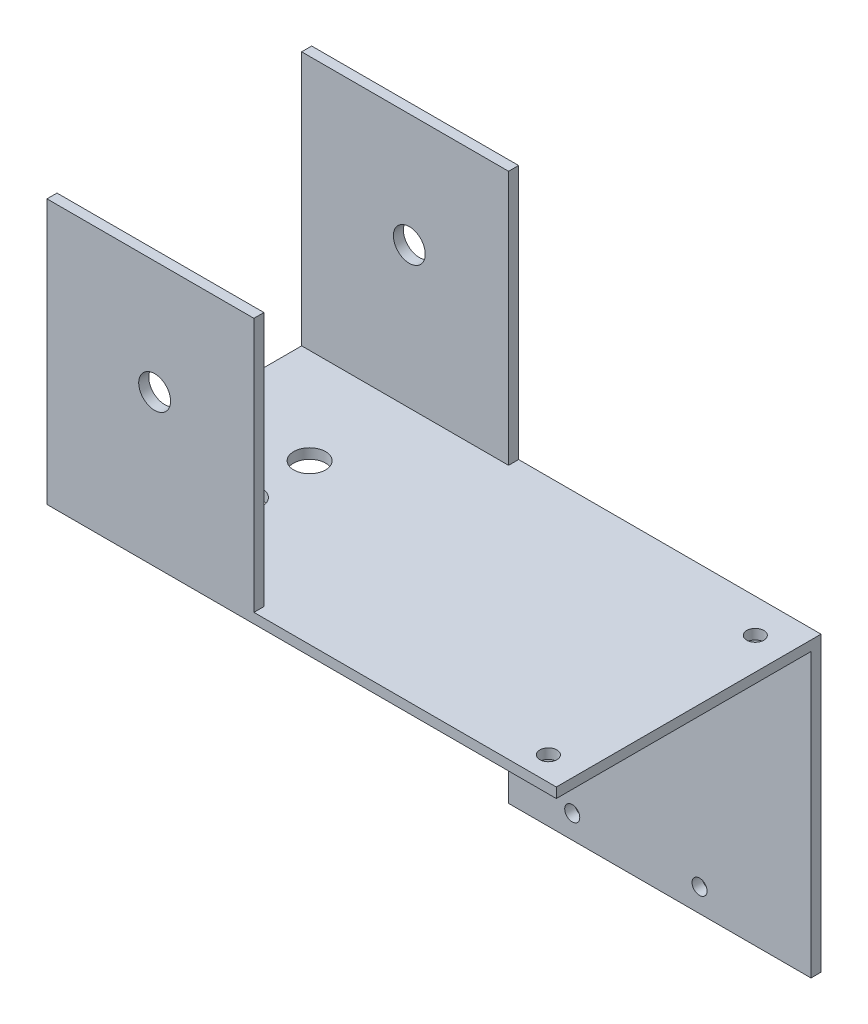
from build123d import *

# Parameters (mm, degrees)
SKETCH1_W           = 60.325
SKETCH1_H           = 58.4
SKETCH1_R           = 1.5
BOSS_EXTRUDE1_DEPTH = 2
BOSS_EXTRUDE2_DEPTH = 52.8
SKETCH3_R           = 1.7
SKETCH3_R_2         = 3.175
CUT_EXTRUDE1_DEPTH  = 99.134120595
SKETCH4_W           = 41.275
SKETCH4_H           = 2
BOSS_EXTRUDE3_DEPTH = 50.8
SKETCH5_R           = 3.175
CUT_EXTRUDE2_DEPTH  = 136.468024364


with BuildPart() as part:
    # Sketch1 → Boss-Extrude1 (new body)
    with BuildSketch(Plane.XY):
        with Locations((30.1625, 29.2)):
            Rectangle(SKETCH1_W, SKETCH1_H)
        with Locations((12.7, 51.75)):
            Circle(SKETCH1_R, mode=Mode.SUBTRACT)
        with Locations((38.1, 51.75)):
            Circle(SKETCH1_R, mode=Mode.SUBTRACT)
        with Locations((12.7, 4.65)):
            Circle(SKETCH1_R, mode=Mode.SUBTRACT)
        with Locations((38.1, 4.65)):
            Circle(SKETCH1_R, mode=Mode.SUBTRACT)
    extrude(amount=-BOSS_EXTRUDE1_DEPTH)

    # Sketch2 → Boss-Extrude2 (add)
    with BuildSketch(Plane(origin=(0, 0, -2), x_dir=(-1, 0, 0), z_dir=(0, 0, -1))):
        Polygon((0, 56.4), (41.275, 56.4), (41.275, 58.4), (0, 58.4), (-60.325, 58.4), (-60.325, 56.4), align=None)
    extrude(amount=-BOSS_EXTRUDE2_DEPTH)

    # Sketch3 → Cut-Extrude1 (cut, through all)
    with BuildSketch(Plane(origin=(0, 58.4, 0), x_dir=(1, 0, 0), z_dir=(0, 1, 0))):
        with Locations((53.975, -4.7625)):
            Circle(SKETCH3_R)
        with Locations((53.975, -46.0375)):
            Circle(SKETCH3_R)
        with Locations((-20.6375, -31.75)):
            Circle(SKETCH3_R_2)
        with Locations((-20.6375, -19.05)):
            Circle(SKETCH3_R_2)
    extrude(amount=-CUT_EXTRUDE1_DEPTH, mode=Mode.SUBTRACT)

    # Sketch4 → Boss-Extrude3 (add)
    with BuildSketch(Plane(origin=(0, 58.4, 0), x_dir=(1, 0, 0), z_dir=(0, 1, 0))):
        with Locations((-20.6375, 1)):
            Rectangle(SKETCH4_W, SKETCH4_H)
        with Locations((-20.6375, -49.8)):
            Rectangle(SKETCH4_W, SKETCH4_H)
    extrude(amount=BOSS_EXTRUDE3_DEPTH)

    # Sketch5 → Cut-Extrude2 (cut, through all)
    with BuildSketch(Plane.XY.offset(50.8)):
        with Locations((-19.8, 86.56795818)):
            Circle(SKETCH5_R)
    extrude(amount=-CUT_EXTRUDE2_DEPTH, mode=Mode.SUBTRACT)


solid = part.part
